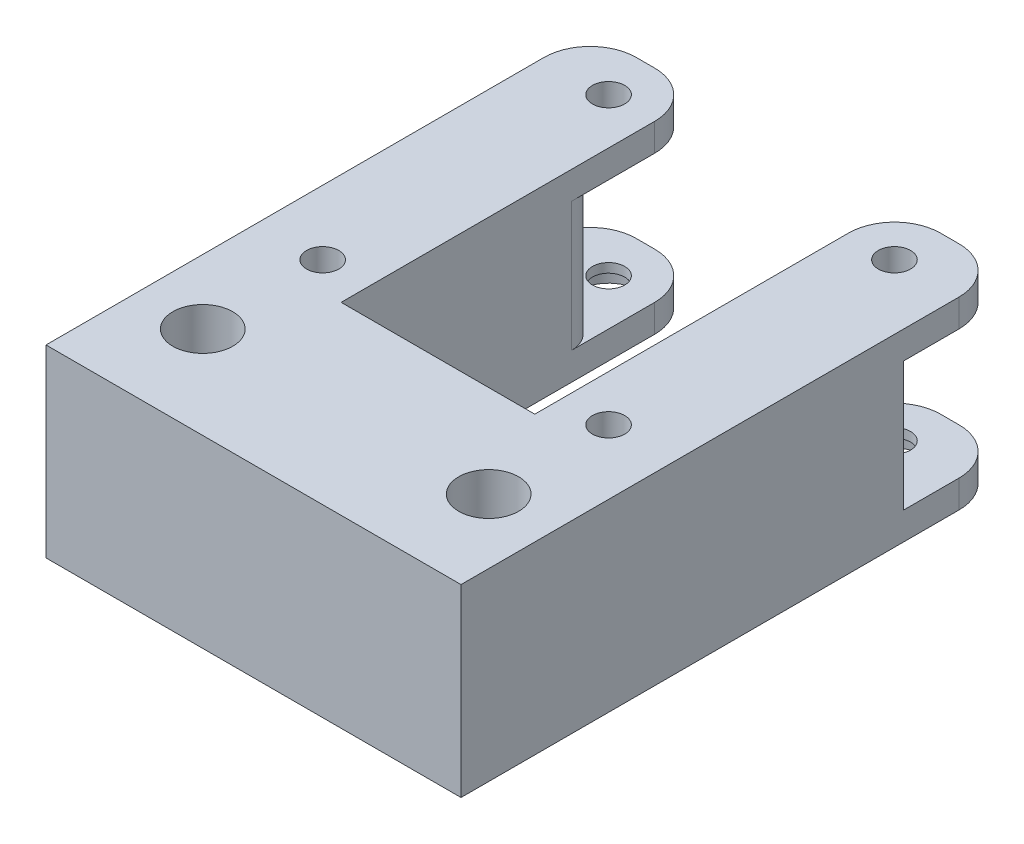
from build123d import *

# Parameters (mm, degrees)
SKETCH1_W                                           = 45
SKETCH1_H                                           = 20
BOSS_EXTRUDE1_DEPTH                                 = 20
SKETCH2_W                                           = 12
SKETCH2_H                                           = 20
BOSS_EXTRUDE2_DEPTH                                 = 40
SKETCH3_R                                           = 1.75
CUT_EXTRUDE1_DEPTH                                  = 59.36308765
SKETCH4_R                                           = 1.75
CUT_EXTRUDE2_DEPTH                                  = 25
CBORE_FOR_M3_HEX_SOCKET_HEAD_CAP_SCREW1_D           = 3.5
CBORE_FOR_M3_HEX_SOCKET_HEAD_CAP_SCREW1_CBORE_D     = 6.5
CBORE_FOR_M3_HEX_SOCKET_HEAD_CAP_SCREW1_CBORE_DEPTH = 11.4
CBORE_FOR_M3_HEX_SOCKET_HEAD_CAP_SCREW2_D           = 3.5
CBORE_FOR_M3_HEX_SOCKET_HEAD_CAP_SCREW2_CBORE_D     = 6.5
CBORE_FOR_M3_HEX_SOCKET_HEAD_CAP_SCREW2_CBORE_DEPTH = 2
CBORE_FOR_M3_PAN_HEAD_SCREW1_D                      = 3.5
CBORE_FOR_M3_PAN_HEAD_SCREW1_CBORE_D                = 6.5
CBORE_FOR_M3_PAN_HEAD_SCREW1_CBORE_DEPTH            = 12.4
CUT_EXTRUDE3_DEPTH                                  = 71.178344238
CUT_EXTRUDE3_DEPTH_BACK                             = 71.178344238
SKETCH9_W                                           = 12
SKETCH9_H                                           = 14
SKETCH10_W                                          = 12
SKETCH10_H                                          = 3
CUT_EXTRUDE5_DEPTH                                  = 1
FILLET2_R                                           = 5
FILLET5_R                                           = 3


with BuildPart() as part:
    # Sketch1 → Boss-Extrude1 (new body)
    with BuildSketch(Plane(origin=(0, 0, 0), x_dir=(1, 0, 0), z_dir=(0, 1, 0))):
        Rectangle(SKETCH1_W, SKETCH1_H)
    extrude(amount=BOSS_EXTRUDE1_DEPTH)

    # Sketch2 → Boss-Extrude2 (add)
    with BuildSketch(Plane(origin=(0, 0, -10), x_dir=(-1, 0, 0), z_dir=(0, 0, -1))):
        with Locations((-16.5, 10)):
            Rectangle(SKETCH2_W, SKETCH2_H)
        with Locations((16.5, 10)):
            Rectangle(SKETCH2_W, SKETCH2_H)
    extrude(amount=BOSS_EXTRUDE2_DEPTH)

    # Sketch3 → Cut-Extrude1 (cut, through all)
    with BuildSketch(Plane(origin=(0, 20, 0), x_dir=(1, 0, 0), z_dir=(0, 1, 0))):
        with Locations((15.5, 44)):
            Circle(SKETCH3_R)
        with Locations((15.5, 13)):
            Circle(SKETCH3_R)
        with Locations((-15.5, 13)):
            Circle(SKETCH3_R)
        with Locations((-15.5, 44)):
            Circle(SKETCH3_R)
    extrude(amount=-CUT_EXTRUDE1_DEPTH, mode=Mode.SUBTRACT)

    # Sketch4 → Cut-Extrude2 (cut)
    with BuildSketch(Plane(origin=(0, 20, 0), x_dir=(1, 0, 0), z_dir=(0, 1, 0))):
        with Locations((-15.5, 0)):
            Circle(SKETCH4_R)
        with Locations((15.5, 0)):
            Circle(SKETCH4_R)
    extrude(amount=-CUT_EXTRUDE2_DEPTH, mode=Mode.SUBTRACT)

    # CBORE for M3 Hex Socket Head Cap Screw1 (through all)
    with Locations(Plane(origin=(0, 20, 0), x_dir=(1, 0, 0), z_dir=(0, 1, 0))):
        with Locations((15.5, 0), (-15.5, 0)):
            CounterBoreHole(CBORE_FOR_M3_HEX_SOCKET_HEAD_CAP_SCREW1_D / 2, CBORE_FOR_M3_HEX_SOCKET_HEAD_CAP_SCREW1_CBORE_D / 2, CBORE_FOR_M3_HEX_SOCKET_HEAD_CAP_SCREW1_CBORE_DEPTH)

    # CBORE for M3 Hex Socket Head Cap Screw2 (through all)
    with Locations(Plane(origin=(0, 0, 0), x_dir=(-1, 0, 0), z_dir=(0, -1, 0))):
        with Locations((15.5, 44), (15.5, 13), (-15.5, 13), (-15.5, 44)):
            CounterBoreHole(CBORE_FOR_M3_HEX_SOCKET_HEAD_CAP_SCREW2_D / 2, CBORE_FOR_M3_HEX_SOCKET_HEAD_CAP_SCREW2_CBORE_D / 2, CBORE_FOR_M3_HEX_SOCKET_HEAD_CAP_SCREW2_CBORE_DEPTH)

    # CBORE for M3 Pan Head Screw1 (through all)
    with Locations(Plane(origin=(0, 0, 0), x_dir=(-1, 0, 0), z_dir=(0, -1, 0))):
        with Locations((-15.5, 13), (15.5, 13)):
            CounterBoreHole(CBORE_FOR_M3_PAN_HEAD_SCREW1_D / 2, CBORE_FOR_M3_PAN_HEAD_SCREW1_CBORE_D / 2, CBORE_FOR_M3_PAN_HEAD_SCREW1_CBORE_DEPTH)

    # Sketch9 → Cut-Extrude3 (cut, two sides: drawn at the far end of the back side and taken through both)
    with BuildSketch(Plane(origin=(22.5, 0, 0), x_dir=(0, 0, -1), z_dir=(1, 0, 0)).offset(-CUT_EXTRUDE3_DEPTH_BACK)):
        with Locations((44, 10)):
            Rectangle(SKETCH9_W, SKETCH9_H)
    extrude(amount=CUT_EXTRUDE3_DEPTH + CUT_EXTRUDE3_DEPTH_BACK, mode=Mode.SUBTRACT)

    # Sketch10 → Cut-Extrude5 (cut)
    with BuildSketch(Plane(origin=(0, 0, -50), x_dir=(-1, 0, 0), z_dir=(0, 0, -1))):
        with Locations((-16.5, 1.5)):
            Rectangle(SKETCH10_W, SKETCH10_H)
        with Locations((16.5, 1.5)):
            Rectangle(SKETCH10_W, SKETCH10_H)
        with Locations((-16.5, 18.5)):
            Rectangle(SKETCH10_W, SKETCH10_H)
        with Locations((16.5, 18.5)):
            Rectangle(SKETCH10_W, SKETCH10_H)
    extrude(amount=-CUT_EXTRUDE5_DEPTH, mode=Mode.SUBTRACT)

    # Fillet2
    fillet2_edges = [part.edges().sort_by_distance(p)[0] for p in [
        (-10.5, 1.5, -49),
        (10.5, 1.5, -49),
        (-10.5, 18.5, -49),
        (10.5, 18.5, -49),
        (-22.5, 18.5, -49),
        (-22.5, 1.5, -49),
        (22.5, 1.5, -49),
        (22.5, 18.5, -49),
    ]]
    fillet(fillet2_edges, radius=FILLET2_R)

    # Fillet5
    fillet5_edges = [part.edges().sort_by_distance(p)[0] for p in [
        (-10.5, 10, -38),
        (10.5, 10, -38),
    ]]
    fillet(fillet5_edges, radius=FILLET5_R)


solid = part.part
